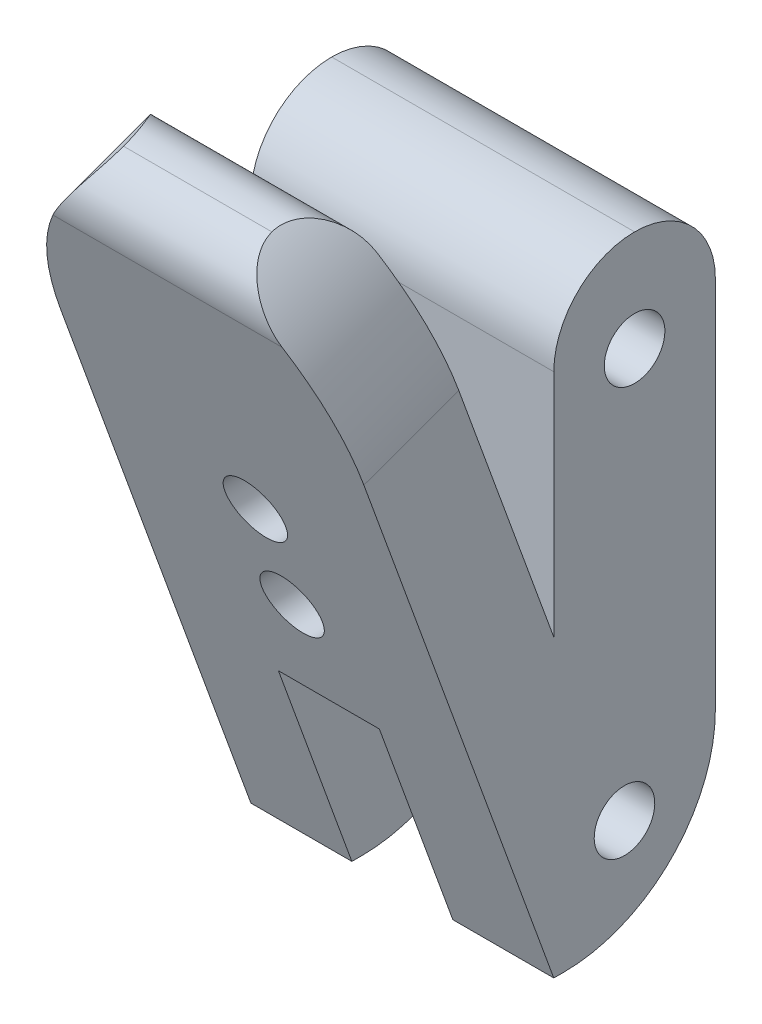
from build123d import *

# Parameters (mm, degrees)
BOSS_EXTRUDE1_DEPTH      = 15
BOSS_EXTRUDE1_DEPTH_BACK = 1
SKETCH1_W                = 30
SKETCH1_H                = 60
SKETCH2_R                = 3
CUT_EXTRUDE1_DEPTH       = 49
FILLET1_R                = 8
SKETCH6_W                = 30
SKETCH6_H                = 80
BOSS_EXTRUDE2_DEPTH      = 10
SKETCH7_R                = 3
CUT_EXTRUDE2_DEPTH       = 38
SKETCH8_R                = 3
CUT_EXTRUDE3_DEPTH       = 49
SKETCH11_W               = 10
SKETCH11_H               = 20
CUT_EXTRUDE4_DEPTH       = 30
FILLET2_R                = 15
FILLET3_R                = 25
CUT_EXTRUDE5_DEPTH       = 10
FILLET5_R                = 5


# Some blends are built 0.0001 mm under size
with BuildPart() as part:
    # Sketch1 → Boss-Extrude1 (new, two sides: drawn at the far end of the back side and taken through both)
    with BuildSketch(Plane.XY.offset(-BOSS_EXTRUDE1_DEPTH_BACK)):
        with Locations((15, -30)):
            Rectangle(SKETCH1_W, SKETCH1_H)
    extrude(amount=BOSS_EXTRUDE1_DEPTH + BOSS_EXTRUDE1_DEPTH_BACK)

    # Sketch2 → Cut-Extrude1 (cut)
    with BuildSketch(Plane.ZY):
        with Locations((7, -10)):
            Circle(SKETCH2_R)
    extrude(amount=-CUT_EXTRUDE1_DEPTH, mode=Mode.SUBTRACT)

    # Fillet1
    fillet1_edges = [part.edges().sort_by_distance(p)[0] for p in [
        (15, 0, 15),
        (15, 0, -1),
    ]]
    fillet(fillet1_edges, radius=FILLET1_R - 0.0001)  # a hair under: the kernel refuses the full size

    # Sketch6 → Boss-Extrude2 (add)
    with BuildSketch(Plane(origin=(0, -11.839573779, 32.528961614), x_dir=(1, 0, 0), z_dir=(0, 0.34202014332566943, -0.9396926207859081))):
        with Locations((15, 11.251255097)):
            Rectangle(SKETCH6_W, SKETCH6_H)
    extrude(amount=BOSS_EXTRUDE2_DEPTH)

    # Sketch7 → Cut-Extrude2 (cut)
    with BuildSketch(Plane(origin=(0, 0, -1), x_dir=(-1, 0, 0), z_dir=(0, 0, -1))):
        with Locations(Location((-15, -20, 0), (0, 0, 270))):
            Circle(SKETCH7_R)
        with Locations((-15, -30)):
            Circle(SKETCH7_R)
    extrude(amount=-CUT_EXTRUDE2_DEPTH, mode=Mode.SUBTRACT)

    # Sketch8 → Cut-Extrude3 (cut)
    with BuildSketch(Plane.ZY):
        with Locations((8, -50)):
            Circle(SKETCH8_R)
    extrude(amount=-CUT_EXTRUDE3_DEPTH, mode=Mode.SUBTRACT)

    # Sketch11 → Cut-Extrude4 (cut)
    with BuildSketch(Plane(origin=(0, 0, -1), x_dir=(-1, 0, 0), z_dir=(0, 0, -1))):
        with Locations((-15, -50)):
            Rectangle(SKETCH11_W, SKETCH11_H)
    extrude(amount=-CUT_EXTRUDE4_DEPTH, mode=Mode.SUBTRACT)

    # Fillet2
    fillet2_edges = [part.edges().sort_by_distance(p)[0] for p in [
        (25, -60, -1),
        (5, -60, -1),
    ]]
    fillet(fillet2_edges, radius=FILLET2_R)

    # Fillet3
    # the kernel refuses this fillet: 25 mm, written as the material it takes off along each edge
    with BuildSketch(Plane(origin=(0, -6.200849295, 101.092400265), x_dir=(1, 0, 0), z_dir=(0, 0.34202014332566943, -0.9396926207859082)), Plane(origin=(30, -6.200849295, 101.092400265), x_dir=(0, -0.9396926207859081, -0.3420201433256693), z_dir=(0, 0.34202014332566943, -0.9396926207859082))) as fillet3_piece_1:
        with BuildLine():
            CenterArc((FILLET3_R, FILLET3_R), FILLET3_R, 180, 90)
            Line((0, FILLET3_R), (0, 0))
            Line((0, 0), (FILLET3_R, 0))
        make_face()
    extrude(amount=135, mode=Mode.SUBTRACT)

    # Sketch12 → Cut-Extrude5 (cut)
    with BuildSketch(Plane(origin=(0, -8.419372346, 23.132035406), x_dir=(-1, 0, 0), z_dir=(0, 0.34202014332566943, -0.9396926207859082))):
        with BuildLine():
            Line((-15, 21.748370766), (-7.650260268, 21.748370766))
            ThreePointArc((-7.650260268, 21.748370766), (-15, 27.089106291), (-22.349739732, 21.748370766))
            Line((-22.349739732, 21.748370766), (-15, 21.748370766))
        make_face()
    extrude(amount=-CUT_EXTRUDE5_DEPTH, mode=Mode.SUBTRACT)

    # Fillet5
    fillet5_edges = [part.edges().sort_by_distance(p)[0] for p in [
        (15, 8.597209744, 39.967342501),
        (15, 12.017411178, 30.570416293),
    ]]
    fillet(fillet5_edges, radius=FILLET5_R - 0.0001)  # a hair under: the kernel refuses the full size


solid = part.part
